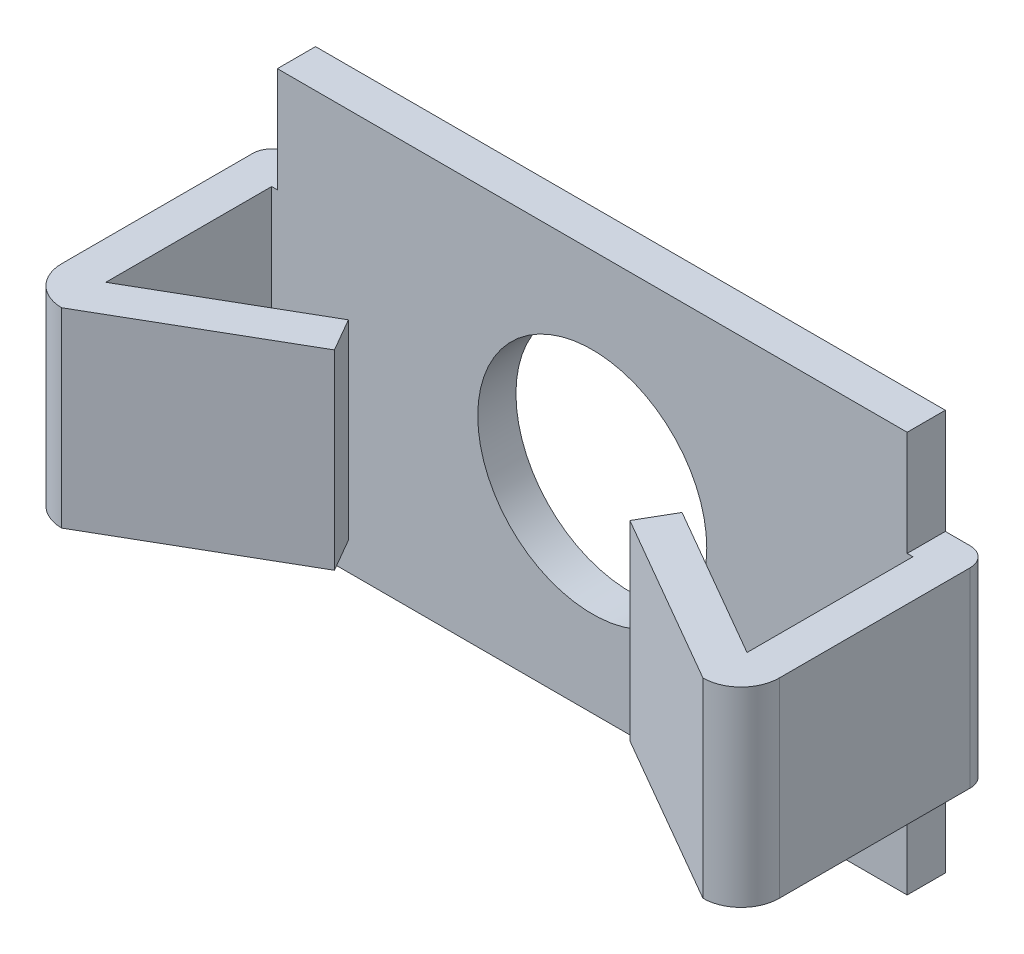
from build123d import *

# Parameters (mm, degrees)
SKETCH_1_W          = 37.6
SKETCH_1_H          = 21
EXTRUDE_1_DEPTH     = 2
SKETCH_2_W          = 2.3
SKETCH_2_H          = 5.5
CUT_EXTRUDE_1_DEPTH = 22.626141588
SKETCH_4_W          = 13
SKETCH_4_H          = 10
EXTRUDE_2_DEPTH     = 2
EXTRUDE_4_DEPTH     = 10
SKETCH_6_R          = 6
CUT_EXTRUDE_2_DEPTH = 26.153329799
FILLET_1_R          = 2
FILLET_2_R          = 1


with BuildPart() as part:
    # 草图1 → 凸台-拉伸1 (new body)
    with BuildSketch(Plane.XY):
        Rectangle(SKETCH_1_W, SKETCH_1_H)
    extrude(amount=EXTRUDE_1_DEPTH)

    # 草图2 → 切除-拉伸1 (cut, through all)
    with BuildSketch(Plane.XY.offset(2)):
        with Locations((-17.65, 7.75)):
            Rectangle(SKETCH_2_W, SKETCH_2_H)
        with Locations((17.65, 7.75)):
            Rectangle(SKETCH_2_W, SKETCH_2_H)
        with Locations((-17.65, -7.75)):
            Rectangle(SKETCH_2_W, SKETCH_2_H)
        with Locations((17.65, -7.75)):
            Rectangle(SKETCH_2_W, SKETCH_2_H)
    extrude(amount=-CUT_EXTRUDE_1_DEPTH, mode=Mode.SUBTRACT)

    # 草图4 → 凸台-拉伸2 (add)
    with BuildSketch(Plane.ZY.offset(18.8)):
        with Locations((6.5, 0)):
            Rectangle(SKETCH_4_W, SKETCH_4_H)
    extrude_2 = extrude(amount=-EXTRUDE_2_DEPTH)

    # 草图5 → 凸台-拉伸4 (add)
    with BuildSketch(Plane(origin=(0, 5, 0), x_dir=(1, 0, 0), z_dir=(0, 1, 0))):
        Polygon((-8.740415593, -6.037395696), (-16.8, -10.690598923), (-16.8, -13), (-7.740415593, -7.769446504), align=None)
    extrude_4 = extrude(amount=-EXTRUDE_4_DEPTH)

    # 草图6 → 切除-拉伸2 (cut, through all)
    with BuildSketch(Plane(origin=(0, 0, 0), x_dir=(-1, 0, 0), z_dir=(0, 0, -1))):
        Circle(SKETCH_6_R)
    extrude(amount=-CUT_EXTRUDE_2_DEPTH, mode=Mode.SUBTRACT)

    # 镜向2: 凸台-拉伸2 across plane
    add(extrude_2.mirror(Plane(origin=(0, 0, 0), x_dir=(0, 0, 1), z_dir=(1, 0, 0))))

    # 镜向3: 凸台-拉伸4 across plane
    add(extrude_4.mirror(Plane(origin=(0, 0, 0), x_dir=(0, 0, 1), z_dir=(1, 0, 0))))

    # 圆角1
    fillet_1_edges = [part.edges().sort_by_distance(p)[0] for p in [
        (18.8, 0, 13),
        (-18.8, 0, 13),
    ]]
    fillet(fillet_1_edges, radius=FILLET_1_R - 0.0001)  # a hair under: the kernel refuses the full size

    # 圆角2
    fillet_2_edges = [part.edges().sort_by_distance(p)[0] for p in [
        (-18.8, 0, 0),
        (18.8, 0, 0),
    ]]
    fillet(fillet_2_edges, radius=FILLET_2_R)


solid = part.part
